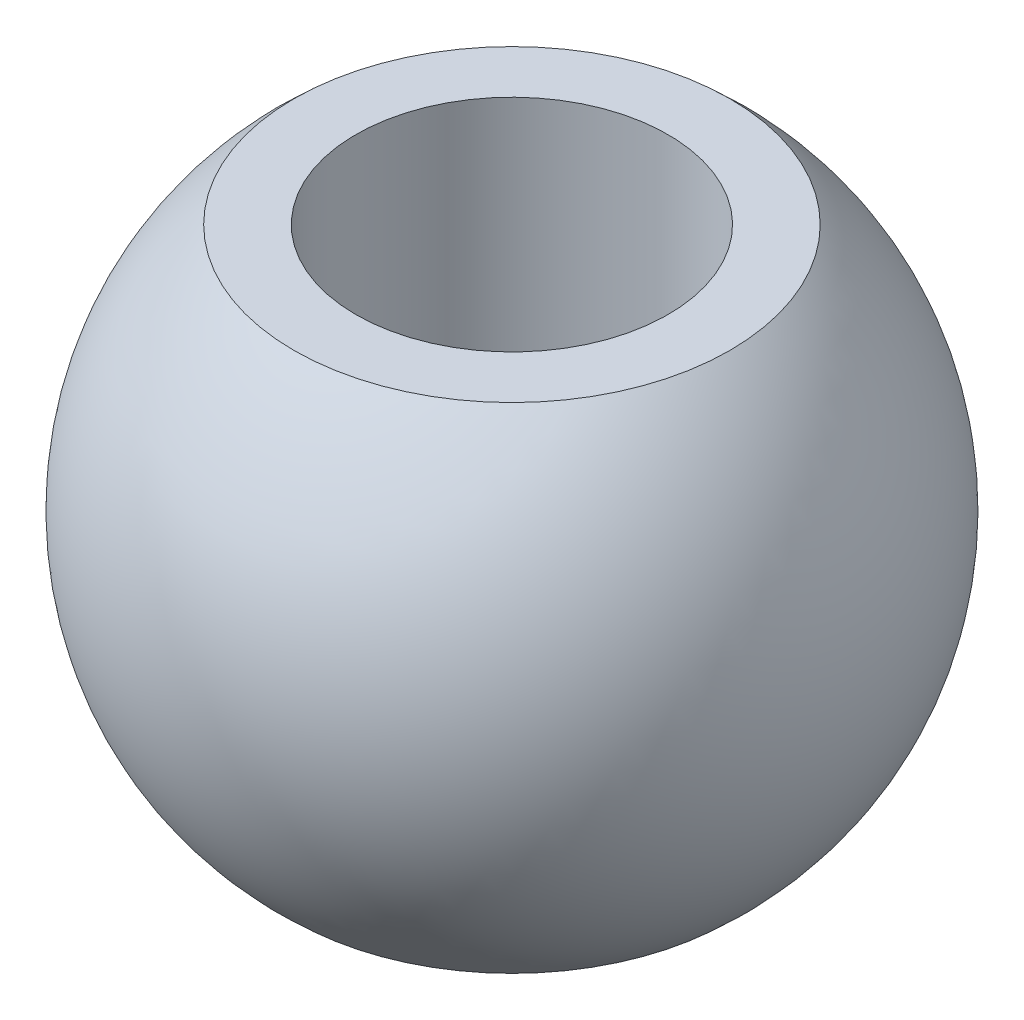
from build123d import *

# Parameters (mm, degrees)
SKETCH2_R      = 2.3876
EXTRUDE1_DEPTH = 6.3721
SKETCH3_R      = 1.1303
EXTRUDE2_DEPTH = 5.922163496


with BuildPart() as part:
    # Sketch1 → Revolve1 (revolve)
    with BuildSketch(Plane.XY):
        with BuildLine():
            Line((0, 2.3876), (0, -2.3876))
            ThreePointArc((0, -2.3876), (2.3876, 0), (0, 2.3876))
        make_face()
    revolve(axis=Axis((0, 2.3876, 0), (0, -1, 0)))

    # Sketch2 → Extrude1 (cut, through all)
    with BuildSketch(Plane(origin=(0, 1.7907, 0), x_dir=(-1, 0, 0), z_dir=(0, 1, 0))):
        Circle(SKETCH2_R)
    extrude1 = extrude(amount=EXTRUDE1_DEPTH, mode=Mode.SUBTRACT)

    # Mirror1: Extrude1 across plane
    add(extrude1.mirror(Plane.ZX), mode=Mode.SUBTRACT)

    # Sketch3 → Extrude2 (cut, through all)
    with BuildSketch(Plane(origin=(0, 1.7907, 0), x_dir=(-1, 0, 0), z_dir=(0, 1, 0))):
        Circle(SKETCH3_R)
    extrude(amount=-EXTRUDE2_DEPTH, mode=Mode.SUBTRACT)


solid = part.part
